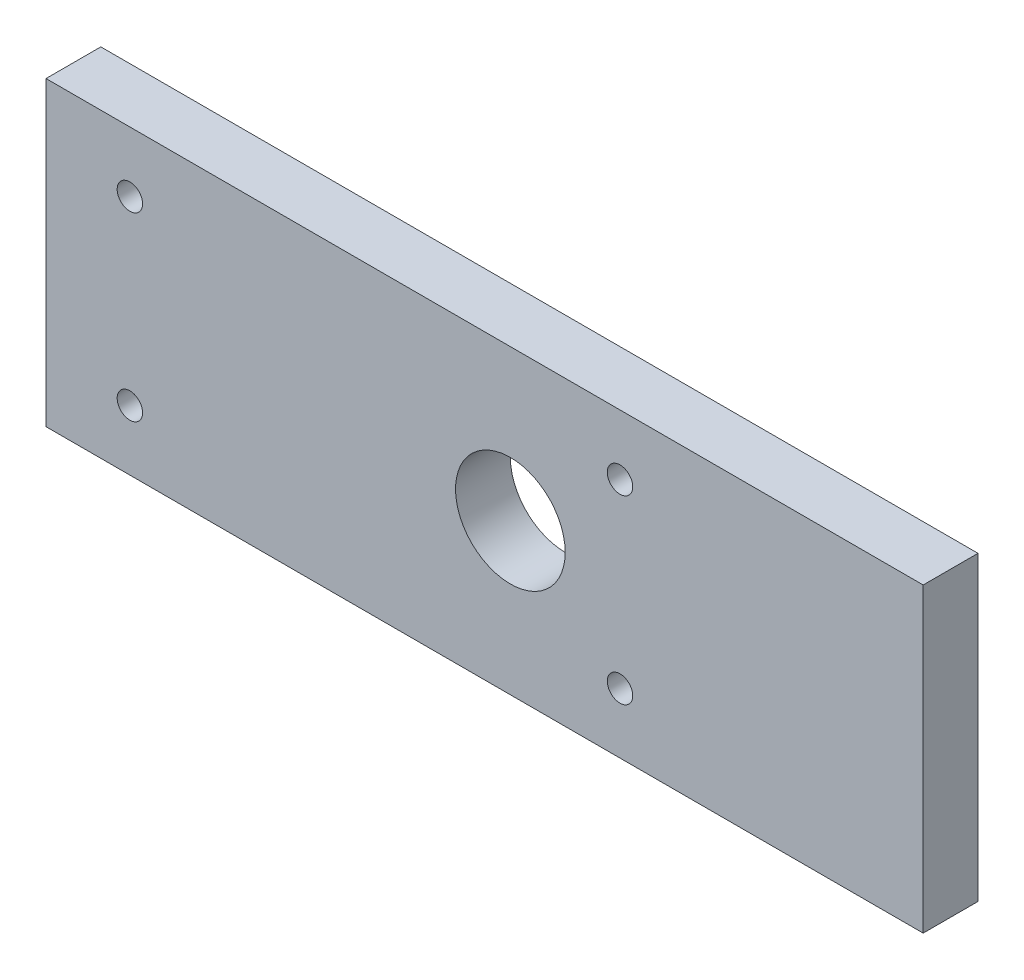
from build123d import *

# Parameters (mm, degrees)
SKETCH1_W               = 101.6
SKETCH1_H               = 34.925
BOSS_EXTRUDE1_DEPTH     = 6.35
ADVANCEDHOLE1_OUTLINE_R = 1.4732
ADVANCEDHOLE1_DEPTH     = 6.35
CUT_EXTRUDE1_REACH      = 68.163
SKETCH5_R               = 6.35


# Read off the part's stored shape, not the designer's step: AdvancedHole1
with BuildPart() as part:
    # Sketch1 → Boss-Extrude1 (new body)
    with BuildSketch(Plane.XY):
        with Locations((12.7, 0)):
            Rectangle(SKETCH1_W, SKETCH1_H)
    extrude(amount=BOSS_EXTRUDE1_DEPTH)

    # AdvancedHole1 outline → AdvancedHole1 (cut)
    with BuildSketch(Plane.XY):
        with Locations((28.3845, 10.4775)):
            Circle(ADVANCEDHOLE1_OUTLINE_R)
        with Locations((28.3845, -10.4775)):
            Circle(ADVANCEDHOLE1_OUTLINE_R)
        with Locations((-28.3845, -10.4775)):
            Circle(ADVANCEDHOLE1_OUTLINE_R)
        with Locations((-28.3845, 10.4775)):
            Circle(ADVANCEDHOLE1_OUTLINE_R)
    extrude(amount=ADVANCEDHOLE1_DEPTH, mode=Mode.SUBTRACT)

    # Sketch5 → Cut-Extrude1 (cut, up to next)
    with BuildSketch(Plane.XY.offset(6.35), mode=Mode.PRIVATE) as cut_extrude1_sk1:
        with Locations((15.6845, 0)):
            Circle(SKETCH5_R)
    cut_extrude1_tool1 = extrude(cut_extrude1_sk1.sketch, amount=-CUT_EXTRUDE1_REACH, mode=Mode.PRIVATE) & part.part
    add(cut_extrude1_tool1.solids().sort_by_distance((15.6845, 0, 6.35))[0], mode=Mode.SUBTRACT)


solid = part.part
